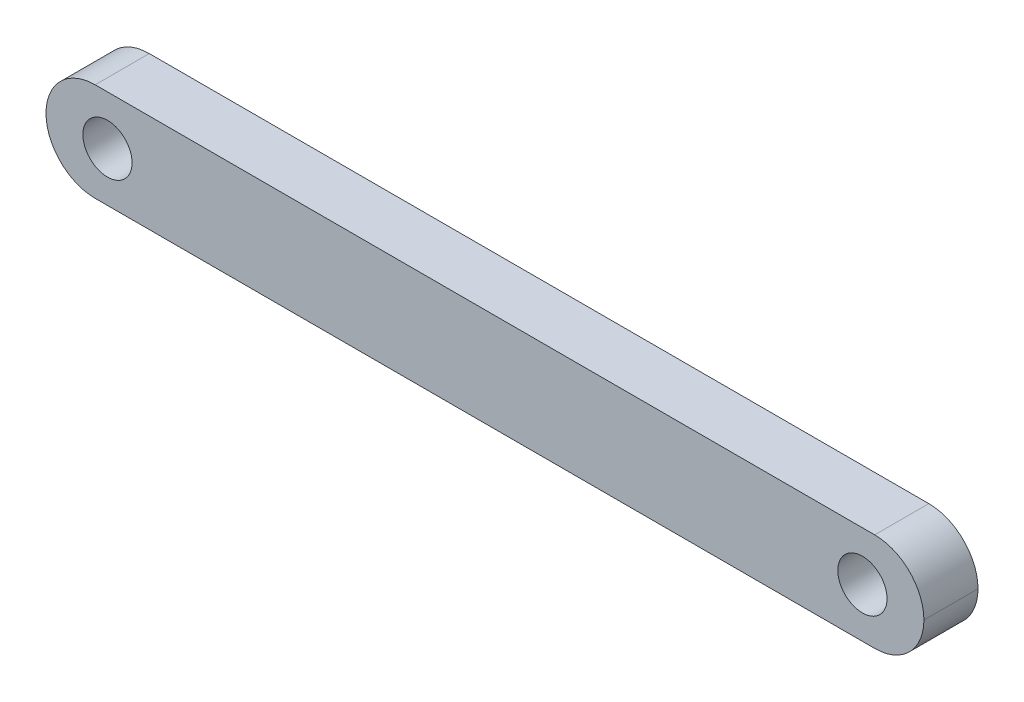
from build123d import *

# Parameters (mm, degrees)
CROQUIS1_W              = 35.7
CROQUIS1_H              = 4
CROQUIS1_R              = 1
SALIENTE_EXTRUIR1_DEPTH = 2.2
REDONDEO1_R             = 2


with BuildPart() as part:
    # Croquis1 → Saliente-Extruir1 (new body)
    with BuildSketch(Plane.XY):
        with Locations((-44.497764467, 10.416666667)):
            Rectangle(CROQUIS1_W, CROQUIS1_H)
        with Locations((-59.847764467, 10.416666667)):
            Circle(CROQUIS1_R, mode=Mode.SUBTRACT)
        with Locations((-29.147764467, 10.416666667)):
            Circle(CROQUIS1_R, mode=Mode.SUBTRACT)
    extrude(amount=SALIENTE_EXTRUIR1_DEPTH)

    # Redondeo1
    redondeo1_edges = [part.edges().sort_by_distance(p)[0] for p in [
        (-62.347764467, 8.416666667, 1.1),
        (-62.347764467, 12.416666667, 1.1),
        (-26.647764467, 8.416666667, 1.1),
        (-26.647764467, 12.416666667, 1.1),
    ]]
    fillet(redondeo1_edges, radius=REDONDEO1_R - 0.0001)  # a hair under: the kernel refuses the full size


solid = part.part
